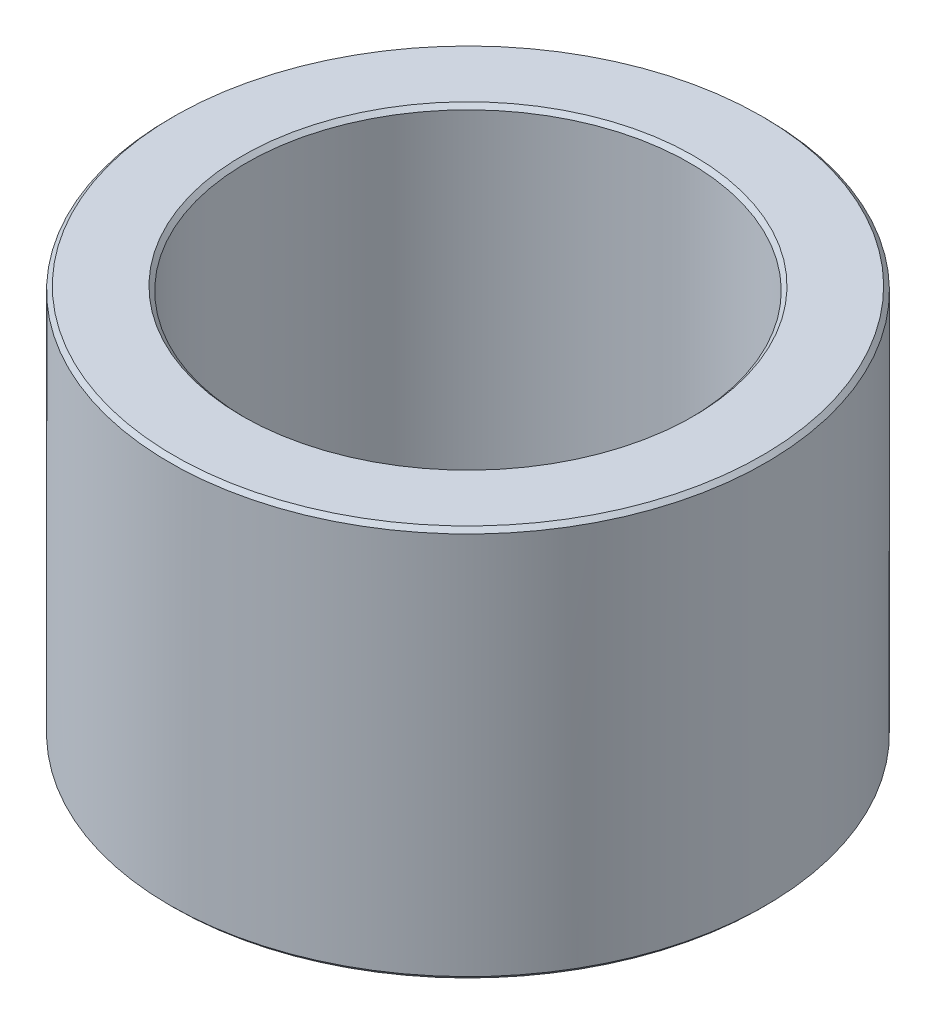
from build123d import *

# Parameters (mm, degrees)
SKETCH1_R           = 30
BOSS_EXTRUDE1_DEPTH = 39.408486414
SKETCH2_R           = 22.300827614
CUT_EXTRUDE1_DEPTH  = 58.905343462
CHAMFER1_SIZE       = 0.410876332


with BuildPart() as part:
    # Sketch1 → Boss-Extrude1 (new body)
    with BuildSketch(Plane(origin=(0, 0, 0), x_dir=(1, 0, 0), z_dir=(0, 1, 0))):
        Circle(SKETCH1_R)
    extrude(amount=BOSS_EXTRUDE1_DEPTH)

    # Sketch2 → Cut-Extrude1 (cut, through all)
    with BuildSketch(Plane(origin=(0, 0, 0), x_dir=(1, 0, 0), z_dir=(0, 1, 0))):
        Circle(SKETCH2_R)
    extrude(amount=CUT_EXTRUDE1_DEPTH, mode=Mode.SUBTRACT)

    # Chamfer1
    chamfer1_edges = [part.edges().sort_by_distance(p)[0] for p in [
        (-22.300827614, 39.408486414, 0),
        (-22.300827614, 0, 0),
        (-30, 0, 0),
        (-30, 39.408486414, 0),
    ]]
    chamfer(chamfer1_edges, length=CHAMFER1_SIZE)


solid = part.part
